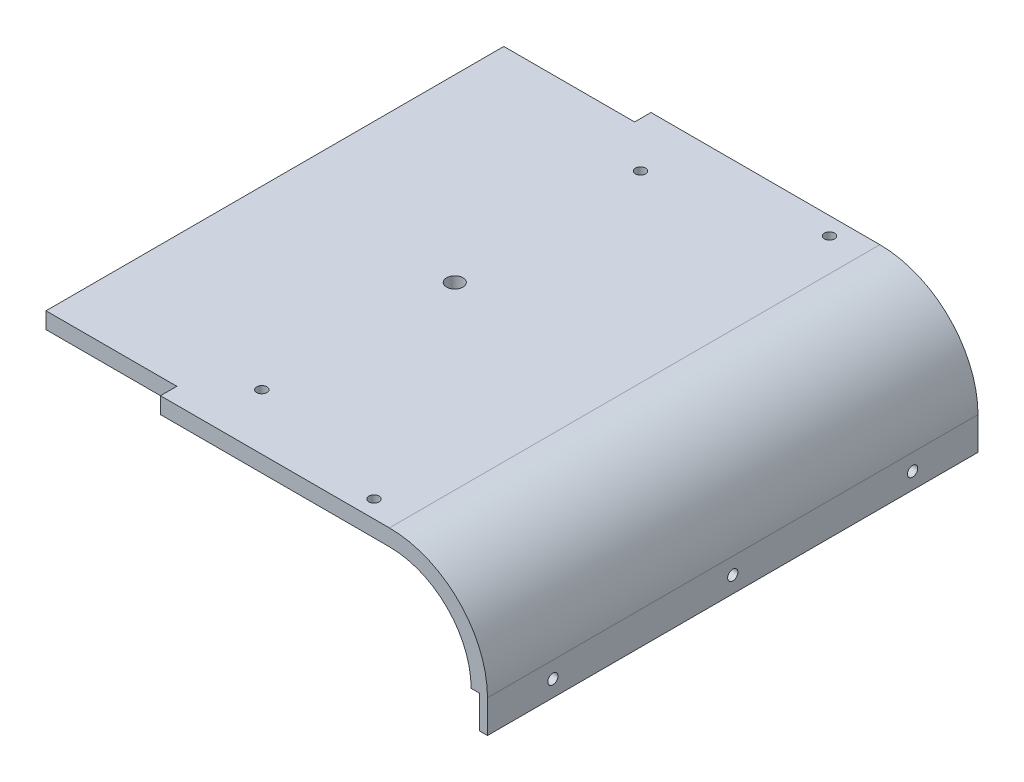
from build123d import *

# Parameters (mm, degrees)
BOSS_EXTRUDE1_DEPTH      = 190.5
BOSS_EXTRUDE1_DEPTH_BACK = 190.5
SKETCH2_W                = 6.35
SKETCH2_H                = 381
BOSS_EXTRUDE2_DEPTH      = 25.4
SKETCH3_R                = 3.96875
CUT_EXTRUDE1_DEPTH       = 25.4
SKETCH4_R                = 6.35
CUT_EXTRUDE2_DEPTH       = 17.78
SKETCH5_R                = 3.937
CUT_EXTRUDE3_DEPTH       = 306.328708116


with BuildPart() as part:
    # Sketch1 → Boss-Extrude1 (new, two sides: drawn at the far end of the back side and taken through both)
    with BuildSketch(Plane.XY.offset(-BOSS_EXTRUDE1_DEPTH_BACK)):
        with BuildLine():
            Line((-139.7, 0), (139.7, 0))
            ThreePointArc((139.7, 0), (193.581536726, -22.318463274), (215.9, -76.2))
            Line((215.9, -76.2), (203.2, -76.2))
            ThreePointArc((203.2, -76.2), (184.601280605, -31.298719395), (139.7, -12.7))
            Line((139.7, -12.7), (-139.7, -12.7))
            Line((-139.7, -12.7), (-139.7, 0))
        make_face()
    extrude(amount=BOSS_EXTRUDE1_DEPTH + BOSS_EXTRUDE1_DEPTH_BACK)

    # Sketch2 → Boss-Extrude2 (add)
    with BuildSketch(Plane.XZ.offset(76.2)):
        with Locations((212.725, 0)):
            Rectangle(SKETCH2_W, SKETCH2_H)
    extrude(amount=BOSS_EXTRUDE2_DEPTH)

    # Sketch3 → Cut-Extrude1 (cut)
    with BuildSketch(Plane(origin=(215.9, 0, 0), x_dir=(0, 0, -1), z_dir=(1, 0, 0))):
        with Locations((-139.7, -88.9)):
            Circle(SKETCH3_R)
        with Locations((0, -88.9)):
            Circle(SKETCH3_R)
        with Locations((139.7, -88.9)):
            Circle(SKETCH3_R)
    extrude(amount=-CUT_EXTRUDE1_DEPTH, mode=Mode.SUBTRACT)

    # Sketch4 → Cut-Extrude2 (cut)
    with BuildSketch(Plane(origin=(0, 0, 0), x_dir=(1, 0, 0), z_dir=(0, 1, 0))):
        Circle(SKETCH4_R)
    extrude(amount=-CUT_EXTRUDE2_DEPTH, mode=Mode.SUBTRACT)

    # Sketch5 → Cut-Extrude3 (cut, through all)
    with BuildSketch(Plane(origin=(0, 0, 0), x_dir=(1, 0, 0), z_dir=(0, 1, 0))):
        with Locations((114.3, -177.038)):
            Circle(SKETCH5_R)
        with Locations((114.3, 176.784)):
            Circle(SKETCH5_R)
        with Locations((-2.794, -147.066)):
            Circle(SKETCH5_R)
        with Locations((-2.794, 147.066)):
            Circle(SKETCH5_R)
        Polygon((-114.3, -177.8), (-139.7, -177.8), (-139.7, -190.5), (-38.1, -190.5), (-38.1, -177.8), align=None)
        Polygon((-38.1, 190.5), (-38.1, 177.8), (-114.3, 177.8), (-139.7, 177.8), (-139.7, 190.5), align=None)
    extrude(amount=-CUT_EXTRUDE3_DEPTH, mode=Mode.SUBTRACT)


solid = part.part
